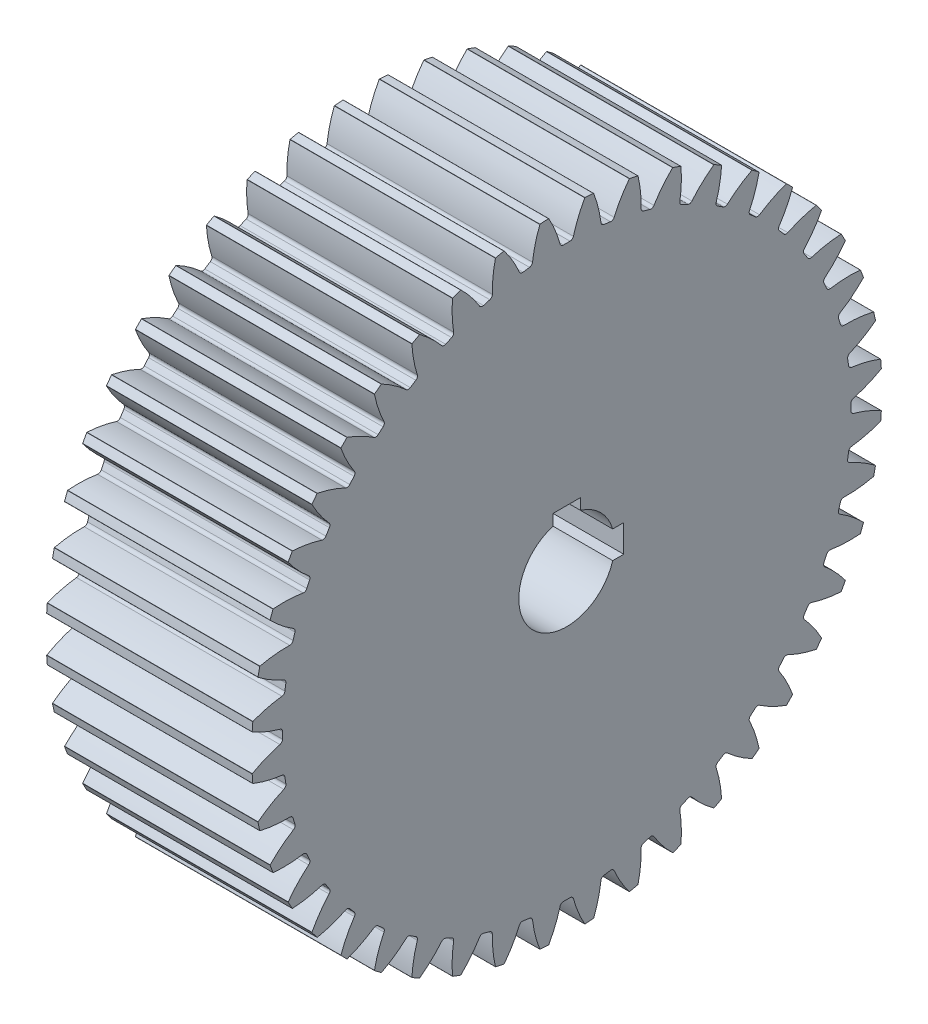
from build123d import *

# Parameters (mm, degrees)
BASPROSKE_W                = 75
BASPROSKE_H                = 115
TOOTHCUT_DEPTH             = 180.094946886
BREAKS_R                   = 0.1
ROOTFILLETS_R              = 1.251
TEETHCUTS_COUNT            = 44
TEETHCUTS_ANGLE            = 351.818181818
BREAKS_OF_TEETHCUTS_R      = 0.1
ROOTFILLETS_OF_TEETHCUTS_R = 1.251
BORSKE_R                   = 17.5
BORE_DEPTH                 = 75.0051308
KEYSKE_W                   = 10
KEYSKE_H                   = 20.8
KEYWAY_DEPTH               = 75.0051308
KEYWAY2_COUNT              = 2
KEYWAY2_ANGLE              = 90


with BuildPart() as part:
    # BasProSke → Base-Revolve (revolve)
    with BuildSketch(Plane(origin=(0, 0, 0), x_dir=(1, 0, 0), z_dir=(0, 1, 0))):
        with Locations((37.5, 57.5)):
            Rectangle(BASPROSKE_W, BASPROSKE_H)
    revolve(axis=Axis((-10, 0, 0), (1, 0, 0)))

    # TooCutSke → ToothCut (cut, through all)
    with BuildSketch(Plane(origin=(0, 0, 0), x_dir=(0, 0, -1), z_dir=(1, 0, 0))):
        with BuildLine():
            ThreePointArc((2.181544439, 103.726061647), (0, 103.749), (-2.181544439, 103.726061647))
            ThreePointArc((-2.181544439, 103.726061647), (-4.020446521, 109.431924722), (-6.617881255, 114.834865319))
            ThreePointArc((-6.617881255, 114.834865319), (0, 115.0254), (6.617881255, 114.834865319))
            ThreePointArc((6.617881255, 114.834865319), (4.020446521, 109.431924722), (2.181544439, 103.726061647))
        make_face()
    toothcut = extrude(amount=TOOTHCUT_DEPTH, mode=Mode.SUBTRACT)

    # Breaks
    breaks_edges = [part.edges().sort_by_distance(p)[0] for p in [
        (37.5, 114.810227877, -6.603906025),
        (37.5, 114.810227877, 6.603906025),
    ]]
    fillet(breaks_edges, radius=BREAKS_R)

    # RootFillets
    rootfillets_edges = [part.edges().sort_by_distance(p)[0] for p in [
        (37.5, 103.726061647, -2.181544439),
        (37.5, 103.726061647, 2.181544439),
    ]]
    fillet(rootfillets_edges, radius=ROOTFILLETS_R)

    # TeethCuts: ToothCut ×44 about axis
    teethcuts_axis = Axis((-10, 0, 0), (1, 0, 0))
    for i in range(1, TEETHCUTS_COUNT):
        add(toothcut.rotate(teethcuts_axis, i * TEETHCUTS_ANGLE / (TEETHCUTS_COUNT - 1)), mode=Mode.SUBTRACT)

    # Breaks of TeethCuts
    breaks_of_teethcuts_edges = [part.edges().sort_by_distance(p)[0] for p in [
        (37.5, 114.581459118, 9.802511229),
        (37.5, 112.701791482, 22.875886796),
        (37.5, 112.020142277, 26.009377622),
        (37.5, 108.299071618, 38.682180481),
        (37.5, 107.178418378, 41.686768092),
        (37.5, 101.691694964, 53.701016521),
        (37.5, 100.154850959, 56.515536178),
        (37.5, 93.014168655, 67.626654726),
        (37.5, 91.092419596, 70.193810925),
        (37.5, 82.443142103, 80.17560926),
        (37.5, 80.17560926, 82.443142103),
        (37.5, 70.193810925, 91.092419596),
        (37.5, 67.626654726, 93.014168655),
        (37.5, 56.515536178, 100.154850959),
        (37.5, 53.701016521, 101.691694964),
        (37.5, 41.686768092, 107.178418378),
        (37.5, 38.682180481, 108.299071618),
        (37.5, 26.009377622, 112.020142277),
        (37.5, 22.875886796, 112.701791482),
        (37.5, 9.802511229, 114.581459118),
        (37.5, 6.603906025, 114.810227877),
        (37.5, -6.603906025, 114.810227877),
        (37.5, -9.802511229, 114.581459118),
        (37.5, -22.875886796, 112.701791482),
        (37.5, -26.009377622, 112.020142277),
        (37.5, -38.682180481, 108.299071618),
        (37.5, -41.686768092, 107.178418378),
        (37.5, -53.701016521, 101.691694964),
        (37.5, -56.515536178, 100.154850959),
        (37.5, -67.626654726, 93.014168655),
        (37.5, -70.193810925, 91.092419596),
        (37.5, -80.17560926, 82.443142103),
        (37.5, -82.443142103, 80.17560926),
        (37.5, -91.092419596, 70.193810925),
        (37.5, -93.014168655, 67.626654726),
        (37.5, -100.154850959, 56.515536178),
        (37.5, -101.691694964, 53.701016521),
        (37.5, -107.178418378, 41.686768092),
        (37.5, -108.299071618, 38.682180481),
        (37.5, -112.020142277, 26.009377622),
        (37.5, -112.701791482, 22.875886796),
        (37.5, -114.581459118, 9.802511229),
        (37.5, -114.810227877, 6.603906025),
        (37.5, -114.810227877, -6.603906025),
        (37.5, -114.581459118, -9.802511229),
        (37.5, -112.701791482, -22.875886796),
        (37.5, -112.020142277, -26.009377622),
        (37.5, -108.299071618, -38.682180481),
        (37.5, -107.178418378, -41.686768092),
        (37.5, -101.691694964, -53.701016521),
        (37.5, -100.154850959, -56.515536178),
        (37.5, -93.014168655, -67.626654726),
        (37.5, -91.092419596, -70.193810925),
        (37.5, -82.443142103, -80.17560926),
        (37.5, -80.17560926, -82.443142103),
        (37.5, -70.193810925, -91.092419596),
        (37.5, -67.626654726, -93.014168655),
        (37.5, -56.515536178, -100.154850959),
        (37.5, -53.701016521, -101.691694964),
        (37.5, -41.686768092, -107.178418378),
        (37.5, -38.682180481, -108.299071618),
        (37.5, -26.009377622, -112.020142277),
        (37.5, -22.875886796, -112.701791482),
        (37.5, -9.802511229, -114.581459118),
        (37.5, -6.603906025, -114.810227877),
        (37.5, 6.603906025, -114.810227877),
        (37.5, 9.802511229, -114.581459118),
        (37.5, 22.875886796, -112.701791482),
        (37.5, 26.009377622, -112.020142277),
        (37.5, 38.682180481, -108.299071618),
        (37.5, 41.686768092, -107.178418378),
        (37.5, 53.701016521, -101.691694964),
        (37.5, 56.515536178, -100.154850959),
        (37.5, 67.626654726, -93.014168655),
        (37.5, 70.193810925, -91.092419596),
        (37.5, 80.17560926, -82.443142103),
        (37.5, 82.443142103, -80.17560926),
        (37.5, 91.092419596, -70.193810925),
        (37.5, 93.014168655, -67.626654726),
        (37.5, 100.154850959, -56.515536178),
        (37.5, 101.691694964, -53.701016521),
        (37.5, 107.178418378, -41.686768092),
        (37.5, 108.299071618, -38.682180481),
        (37.5, 112.020142277, -26.009377622),
        (37.5, 112.701791482, -22.875886796),
        (37.5, 114.581459118, -9.802511229),
    ]]
    fillet(breaks_of_teethcuts_edges, radius=BREAKS_OF_TEETHCUTS_R)

    # RootFillets of TeethCuts
    rootfillets_of_teethcuts_edges = [part.edges().sort_by_distance(p)[0] for p in [
        (37.5, 102.980746044, 12.602418226),
        (37.5, 102.359813756, 16.921097151),
        (37.5, 100.139039424, 27.129831998),
        (37.5, 98.909815239, 31.31618512),
        (37.5, 95.258790738, 41.104960627),
        (37.5, 93.446298115, 45.073765869),
        (37.5, 88.439347776, 54.243310794),
        (37.5, 86.080483838, 57.913774727),
        (37.5, 79.819534732, 66.277423578),
        (37.5, 76.962319147, 69.574826141),
        (37.5, 69.574826141, 76.962319147),
        (37.5, 66.277423578, 79.819534732),
        (37.5, 57.913774727, 86.080483838),
        (37.5, 54.243310794, 88.439347776),
        (37.5, 45.073765869, 93.446298115),
        (37.5, 41.104960627, 95.258790738),
        (37.5, 31.31618512, 98.909815239),
        (37.5, 27.129831998, 100.139039424),
        (37.5, 16.921097151, 102.359813756),
        (37.5, 12.602418226, 102.980746044),
        (37.5, 2.181544439, 103.726061647),
        (37.5, -2.181544439, 103.726061647),
        (37.5, -12.602418226, 102.980746044),
        (37.5, -16.921097151, 102.359813756),
        (37.5, -27.129831998, 100.139039424),
        (37.5, -31.31618512, 98.909815239),
        (37.5, -41.104960627, 95.258790738),
        (37.5, -45.073765869, 93.446298115),
        (37.5, -54.243310794, 88.439347776),
        (37.5, -57.913774727, 86.080483838),
        (37.5, -66.277423578, 79.819534732),
        (37.5, -69.574826141, 76.962319147),
        (37.5, -76.962319147, 69.574826141),
        (37.5, -79.819534732, 66.277423578),
        (37.5, -86.080483838, 57.913774727),
        (37.5, -88.439347776, 54.243310794),
        (37.5, -93.446298115, 45.073765869),
        (37.5, -95.258790738, 41.104960627),
        (37.5, -98.909815239, 31.31618512),
        (37.5, -100.139039424, 27.129831998),
        (37.5, -102.359813756, 16.921097151),
        (37.5, -102.980746044, 12.602418226),
        (37.5, -103.726061647, 2.181544439),
        (37.5, -103.726061647, -2.181544439),
        (37.5, -102.980746044, -12.602418226),
        (37.5, -102.359813756, -16.921097151),
        (37.5, -100.139039424, -27.129831998),
        (37.5, -98.909815239, -31.31618512),
        (37.5, -95.258790738, -41.104960627),
        (37.5, -93.446298115, -45.073765869),
        (37.5, -88.439347776, -54.243310794),
        (37.5, -86.080483838, -57.913774727),
        (37.5, -79.819534732, -66.277423578),
        (37.5, -76.962319147, -69.574826141),
        (37.5, -69.574826141, -76.962319147),
        (37.5, -66.277423578, -79.819534732),
        (37.5, -57.913774727, -86.080483838),
        (37.5, -54.243310794, -88.439347776),
        (37.5, -45.073765869, -93.446298115),
        (37.5, -41.104960627, -95.258790738),
        (37.5, -31.31618512, -98.909815239),
        (37.5, -27.129831998, -100.139039424),
        (37.5, -16.921097151, -102.359813756),
        (37.5, -12.602418226, -102.980746044),
        (37.5, -2.181544439, -103.726061647),
        (37.5, 2.181544439, -103.726061647),
        (37.5, 12.602418226, -102.980746044),
        (37.5, 16.921097151, -102.359813756),
        (37.5, 27.129831998, -100.139039424),
        (37.5, 31.31618512, -98.909815239),
        (37.5, 41.104960627, -95.258790738),
        (37.5, 45.073765869, -93.446298115),
        (37.5, 54.243310794, -88.439347776),
        (37.5, 57.913774727, -86.080483838),
        (37.5, 66.277423578, -79.819534732),
        (37.5, 69.574826141, -76.962319147),
        (37.5, 76.962319147, -69.574826141),
        (37.5, 79.819534732, -66.277423578),
        (37.5, 86.080483838, -57.913774727),
        (37.5, 88.439347776, -54.243310794),
        (37.5, 93.446298115, -45.073765869),
        (37.5, 95.258790738, -41.104960627),
        (37.5, 98.909815239, -31.31618512),
        (37.5, 100.139039424, -27.129831998),
        (37.5, 102.359813756, -16.921097151),
        (37.5, 102.980746044, -12.602418226),
    ]]
    fillet(rootfillets_of_teethcuts_edges, radius=ROOTFILLETS_OF_TEETHCUTS_R)

    # BorSke → Bore (cut, symmetric)
    with BuildSketch(Plane(origin=(0, 0, 0), x_dir=(0, 0, -1), z_dir=(1, 0, 0))):
        Circle(BORSKE_R)
    extrude(amount=BORE_DEPTH, both=True, mode=Mode.SUBTRACT)

    # KeySke → Keyway (cut, symmetric)
    with BuildSketch(Plane(origin=(0, 0, 0), x_dir=(0, 0, -1), z_dir=(1, 0, 0))):
        with Locations((0, 10.4)):
            Rectangle(KEYSKE_W, KEYSKE_H)
    keyway = extrude(amount=KEYWAY_DEPTH, both=True, mode=Mode.SUBTRACT)

    # Keyway2: Keyway ×2 about axis
    keyway2_axis = Axis((-10, 0, 0), (-1, 0, 0))
    for i in range(1, KEYWAY2_COUNT):
        add(keyway.rotate(keyway2_axis, i * KEYWAY2_ANGLE / (KEYWAY2_COUNT - 1)), mode=Mode.SUBTRACT)

    # Sketch1 → Cut-Revolve1 (revolve, cut)
    with BuildSketch(Plane(origin=(0, 0, 0), x_dir=(1, 0, 0), z_dir=(0, 1, 0))):
        with BuildLine():
            Line((-17.833111593, 63.948712126), (22.181015999, 63.948712126))
            ThreePointArc((22.181015999, 63.948712126), (29.242094095, 61.023917814), (32.166888407, 53.962839718))
            Line((32.166888407, 53.962839718), (32.166888407, 35.934584535))
            ThreePointArc((32.166888407, 35.934584535), (29.242094095, 28.873506439), (22.181015999, 25.948712126))
            Line((22.181015999, 25.948712126), (-17.833111593, 25.948712126))
            Line((-17.833111593, 25.948712126), (-17.833111593, 63.948712126))
        make_face()
    revolve(axis=Axis((75, 0, 0), (-1, 0, 0)), mode=Mode.SUBTRACT)


solid = part.part
